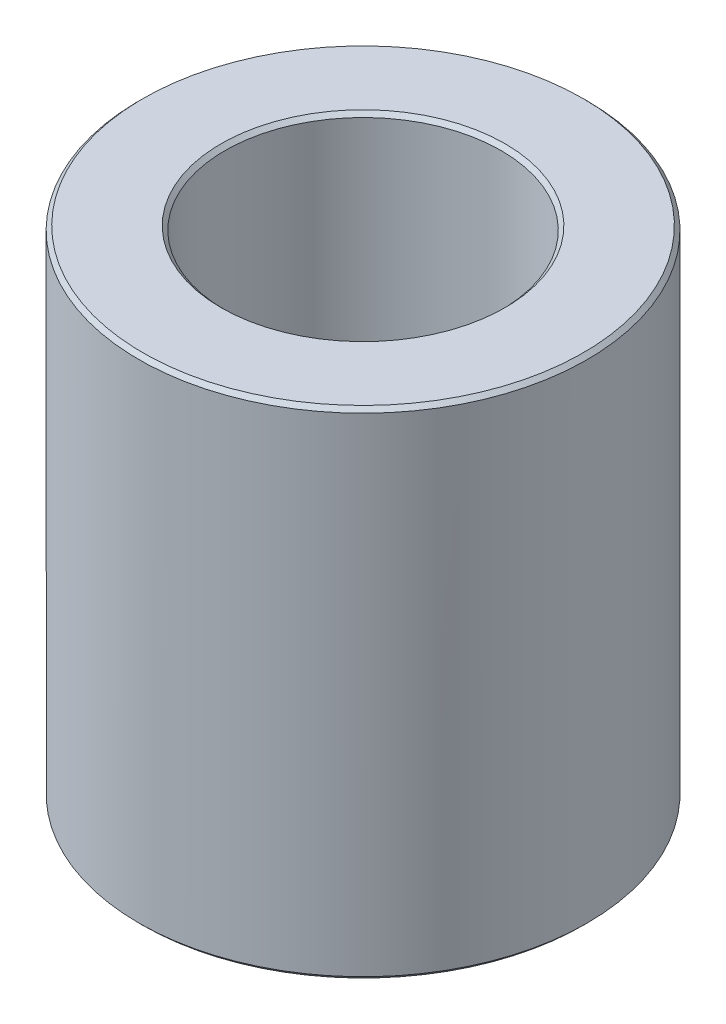
from build123d import *

# Parameters (mm, degrees)
SKETCH1_R           = 47.5
BOSS_EXTRUDE1_DEPTH = 105.10376971
SKETCH2_R           = 29.266092282
CUT_EXTRUDE1_DEPTH  = 125.736932812
CHAMFER1_SIZE       = 0.836841465


with BuildPart() as part:
    # Sketch1 → Boss-Extrude1 (new body)
    with BuildSketch(Plane(origin=(0, 0, 0), x_dir=(1, 0, 0), z_dir=(0, 1, 0))):
        Circle(SKETCH1_R)
    extrude(amount=BOSS_EXTRUDE1_DEPTH)

    # Sketch2 → Cut-Extrude1 (cut, through all)
    with BuildSketch(Plane(origin=(0, 0, 0), x_dir=(1, 0, 0), z_dir=(0, 1, 0))):
        Circle(SKETCH2_R)
    extrude(amount=CUT_EXTRUDE1_DEPTH, mode=Mode.SUBTRACT)

    # Chamfer1
    chamfer1_edges = [part.edges().sort_by_distance(p)[0] for p in [
        (-29.266092282, 105.10376971, 0),
        (-29.266092282, 0, 0),
        (-47.5, 0, 0),
        (-47.5, 105.10376971, 0),
    ]]
    chamfer(chamfer1_edges, length=CHAMFER1_SIZE)


solid = part.part
